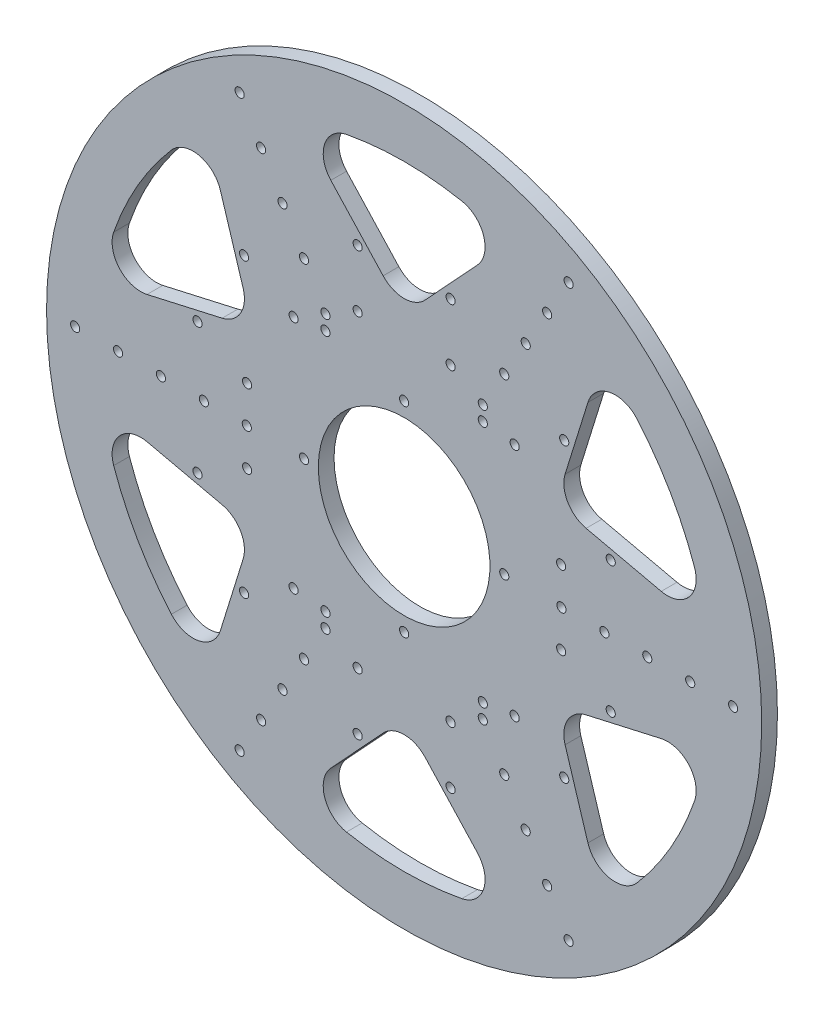
from build123d import *

# Parameters (mm, degrees)
SKETCH_1_R               = 125
EXTRUDE_1_DEPTH          = 5.5
SKETCH_3_R               = 1.6
CUT_EXTRUDE_1_DEPTH      = 177.862234522
PATTERN_CIRCULAR_1_COUNT = 6
SKETCH_4_R               = 30
SKETCH_4_R_2             = 1.6
CUT_EXTRUDE_2_DEPTH      = 177.862234522
SKETCH_5_R               = 1.6
CUT_EXTRUDE_3_DEPTH      = 177.862234522
SKETCH_6_R               = 1.6
CUT_EXTRUDE_4_DEPTH      = 177.862234522


with BuildPart() as part:
    # ｽｹｯﾁ1 → ﾎﾞｽ - 押し出し1 (new body)
    with BuildSketch(Plane.XY):
        Circle(SKETCH_1_R)
    extrude(amount=EXTRUDE_1_DEPTH)

    # ｽｹｯﾁ3 → ｶｯﾄ - 押し出し1 (cut, through all)
    with BuildSketch(Plane(origin=(0, 0, 0), x_dir=(-1, 0, 0), z_dir=(0, 0, -1))):
        with Locations((-16.25, 74)):
            Circle(SKETCH_3_R)
        with Locations((-16.25, 54)):
            Circle(SKETCH_3_R)
        with Locations((16.25, 54)):
            Circle(SKETCH_3_R)
        with Locations((16.25, 74)):
            Circle(SKETCH_3_R)
        with BuildLine():
            Line((-25.629768191, 88.978306263), (-7.34049422, 69.209039494))
            ThreePointArc((-7.34049422, 69.209039494), (0, 66), (7.34049422, 69.209039494))
            Line((7.34049422, 69.209039494), (25.629768191, 88.978306263))
            ThreePointArc((25.629768191, 88.978306263), (27.788579257, 98.893878596), (20.165096942, 105.591755669))
            ThreePointArc((20.165096942, 105.591755669), (0, 107.5), (-20.165096942, 105.591755669))
            ThreePointArc((-20.165096942, 105.591755669), (-27.788579257, 98.893878596), (-25.629768191, 88.978306263))
        make_face()
    cut_extrude_1 = extrude(amount=-CUT_EXTRUDE_1_DEPTH, mode=Mode.SUBTRACT)

    # 円形ﾊﾟﾀｰﾝ1: ｶｯﾄ - 押し出し1 ×6 about axis
    pattern_circular_1_axis = Axis((0, 0, 0), (0, 0, 1))
    for i in range(1, PATTERN_CIRCULAR_1_COUNT):
        add(cut_extrude_1.rotate(pattern_circular_1_axis, i * 360 / PATTERN_CIRCULAR_1_COUNT), mode=Mode.SUBTRACT)

    # ｽｹｯﾁ4 → ｶｯﾄ - 押し出し2 (cut, through all)
    with BuildSketch(Plane(origin=(0, 0, 0), x_dir=(-1, 0, 0), z_dir=(0, 0, -1))):
        Circle(SKETCH_4_R)
        with Locations((0, 35)):
            Circle(SKETCH_4_R_2)
        with Locations((35, 0)):
            Circle(SKETCH_4_R_2)
        with Locations((0, -35)):
            Circle(SKETCH_4_R_2)
        with Locations((-35, 0)):
            Circle(SKETCH_4_R_2)
    extrude(amount=-CUT_EXTRUDE_2_DEPTH, mode=Mode.SUBTRACT)

    # ｽｹｯﾁ5 → ｶｯﾄ - 押し出し3 (cut, through all)
    with BuildSketch(Plane(origin=(0, 0, 0), x_dir=(-1, 0, 0), z_dir=(0, 0, -1))):
        with Locations((-27.5, 42.5)):
            Circle(SKETCH_5_R)
        with Locations((27.5, 42.5)):
            Circle(SKETCH_5_R)
        with Locations((-27.5, -42.5)):
            Circle(SKETCH_5_R)
        with Locations((27.5, -42.5)):
            Circle(SKETCH_5_R)
    extrude(amount=-CUT_EXTRUDE_3_DEPTH, mode=Mode.SUBTRACT)

    # ｽｹｯﾁ6 → ｶｯﾄ - 押し出し4 (cut, through all)
    with BuildSketch(Plane(origin=(0, 0, 0), x_dir=(-1, 0, 0), z_dir=(0, 0, -1))):
        with Locations((-115, 0)):
            Circle(SKETCH_6_R)
        with Locations((-100, 0)):
            Circle(SKETCH_6_R)
        with Locations((-85, 0)):
            Circle(SKETCH_6_R)
        with Locations((-70, 0)):
            Circle(SKETCH_6_R)
        with Locations((-55, 0)):
            Circle(SKETCH_6_R)
        with Locations((-57.5, 99.592921435)):
            Circle(SKETCH_6_R)
        with Locations((-50, 86.602540378)):
            Circle(SKETCH_6_R)
        with Locations((-42.5, 73.612159322)):
            Circle(SKETCH_6_R)
        with Locations((-35, 60.621778265)):
            Circle(SKETCH_6_R)
        with Locations((-27.5, 47.631397208)):
            Circle(SKETCH_6_R)
        with Locations((57.5, 99.592921435)):
            Circle(SKETCH_6_R)
        with Locations((50, 86.602540378)):
            Circle(SKETCH_6_R)
        with Locations((42.5, 73.612159322)):
            Circle(SKETCH_6_R)
        with Locations((35, 60.621778265)):
            Circle(SKETCH_6_R)
        with Locations((27.5, 47.631397208)):
            Circle(SKETCH_6_R)
        with Locations((115, 0)):
            Circle(SKETCH_6_R)
        with Locations((100, 0)):
            Circle(SKETCH_6_R)
        with Locations((85, 0)):
            Circle(SKETCH_6_R)
        with Locations((70, 0)):
            Circle(SKETCH_6_R)
        with Locations((55, 0)):
            Circle(SKETCH_6_R)
        with Locations((57.5, -99.592921435)):
            Circle(SKETCH_6_R)
        with Locations((50, -86.602540378)):
            Circle(SKETCH_6_R)
        with Locations((42.5, -73.612159322)):
            Circle(SKETCH_6_R)
        with Locations((35, -60.621778265)):
            Circle(SKETCH_6_R)
        with Locations((27.5, -47.631397208)):
            Circle(SKETCH_6_R)
        with Locations((-57.5, -99.592921435)):
            Circle(SKETCH_6_R)
        with Locations((-50, -86.602540378)):
            Circle(SKETCH_6_R)
        with Locations((-42.5, -73.612159322)):
            Circle(SKETCH_6_R)
        with Locations((-35, -60.621778265)):
            Circle(SKETCH_6_R)
        with Locations((-27.5, -47.631397208)):
            Circle(SKETCH_6_R)
    extrude(amount=-CUT_EXTRUDE_4_DEPTH, mode=Mode.SUBTRACT)


solid = part.part
